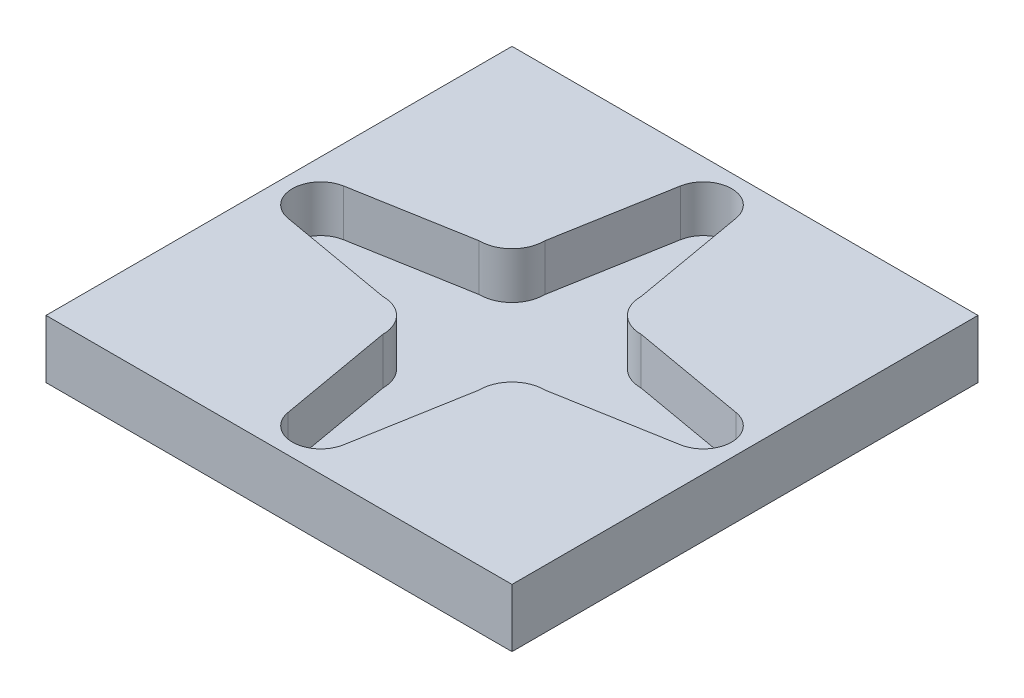
from build123d import *

# Parameters (mm, degrees)
SKETCH1_R             = 50
BOSS_EXTRUDE1_DEPTH   = 5
CAVITY1_START         = 1
CAVITY1_OUTLINE_R     = 4.45
CAVITY1_OUTLINE_R_2   = 3.45
CAVITY1_OUTLINE_R_3   = 2.9
CAVITY1_DEPTH         = 2.65
CAVITY1_START_2       = 2
CAVITY1_2_OUTLINE_R   = 4.45
CAVITY1_2_OUTLINE_R_2 = 3.45
CAVITY1_2_OUTLINE_R_3 = 2.9
CAVITY1_2_OUTLINE_R_4 = 1.5
CAVITY1_2_DEPTH       = 1.65
CAVITY1_START_3       = 3.65
CAVITY1_3_OUTLINE_R   = 4.25
CAVITY1_3_OUTLINE_R_2 = 3
CAVITY1_3_DEPTH       = 1.35
CUT_EXTRUDE4_DEPTH    = 4
CUT_EXTRUDE5_START    = -10
SKETCH4_R             = 50
SKETCH4_W             = 40
SKETCH4_H             = 40
CUT_EXTRUDE5_DEPTH    = 10


# Read off the part's stored shape, not the designer's step: Cavity1
with BuildPart() as part:
    # Sketch1 → Boss-Extrude1 (new body)
    with BuildSketch(Plane(origin=(0, 0, 0), x_dir=(1, 0, 0), z_dir=(0, 1, 0))):
        with Locations(Location((0, 0, 0), (0, 0, 270))):
            Circle(SKETCH1_R)
    extrude(amount=BOSS_EXTRUDE1_DEPTH)

    # Cavity1 outline → Cavity1 (cut)
    # profile 1 of 2: a face of its own
    with BuildSketch(Plane(origin=(0, 0, 0), x_dir=(1, 0, 0), z_dir=(0, 1, 0)).offset(CAVITY1_START)):
        with BuildLine():
            Line((-3.736481777, -6.923723208), (-2, -16.771800738))
            ThreePointArc((-2, -16.771800738), (0, -18.45), (2, -16.771800738))
            Line((2, -16.771800738), (3.736481777, -6.923723208))
            ThreePointArc((3.736481777, -6.923723208), (4.670003178, -4.670003178), (6.923723208, -3.736481777))
            Line((6.923723208, -3.736481777), (16.771800738, -2))
            ThreePointArc((16.771800738, -2), (18.45, 0), (16.771800738, 2))
            Line((16.771800738, 2), (6.923723208, 3.736481777))
            ThreePointArc((6.923723208, 3.736481777), (4.670003178, 4.670003178), (3.736481777, 6.923723208))
            Line((3.736481777, 6.923723208), (2, 16.771800738))
            ThreePointArc((2, 16.771800738), (0, 18.45), (-2, 16.771800738))
            Line((-2, 16.771800738), (-3.736481777, 6.923723208))
            ThreePointArc((-3.736481777, 6.923723208), (-4.670003178, 4.670003178), (-6.923723208, 3.736481777))
            Line((-6.923723208, 3.736481777), (-16.771800738, 2))
            ThreePointArc((-16.771800738, 2), (-18.45, 0), (-16.771800738, -2))
            Line((-16.771800738, -2), (-6.923723208, -3.736481777))
            ThreePointArc((-6.923723208, -3.736481777), (-4.670003178, -4.670003178), (-3.736481777, -6.923723208))
        make_face()
        Circle(CAVITY1_OUTLINE_R, mode=Mode.SUBTRACT)
    # profile 2 of 2: a face of its own
    with BuildSketch(Plane(origin=(0, 0, 0), x_dir=(1, 0, 0), z_dir=(0, 1, 0)).offset(CAVITY1_START)):
        Circle(CAVITY1_OUTLINE_R_2)
        Circle(CAVITY1_OUTLINE_R_3, mode=Mode.SUBTRACT)
    extrude(amount=CAVITY1_DEPTH, mode=Mode.SUBTRACT)

    # Cavity1 2 outline → Cavity1 2 (cut)
    # profile 1 of 2: a face of its own
    with BuildSketch(Plane(origin=(0, 0, 0), x_dir=(1, 0, 0), z_dir=(0, 1, 0)).offset(CAVITY1_START_2)):
        Circle(CAVITY1_2_OUTLINE_R)
        Circle(CAVITY1_2_OUTLINE_R_2, mode=Mode.SUBTRACT)
    # profile 2 of 2: a face of its own
    with BuildSketch(Plane(origin=(0, 0, 0), x_dir=(1, 0, 0), z_dir=(0, 1, 0)).offset(CAVITY1_START_2)):
        Circle(CAVITY1_2_OUTLINE_R_3)
        Circle(CAVITY1_2_OUTLINE_R_4, mode=Mode.SUBTRACT)
    extrude(amount=CAVITY1_2_DEPTH, mode=Mode.SUBTRACT)

    # Cavity1 3 outline → Cavity1 3 (cut)
    with BuildSketch(Plane(origin=(0, 0, 0), x_dir=(1, 0, 0), z_dir=(0, 1, 0)).offset(CAVITY1_START_3)):
        Circle(CAVITY1_3_OUTLINE_R)
        Circle(CAVITY1_3_OUTLINE_R_2, mode=Mode.SUBTRACT)
    extrude(amount=CAVITY1_3_DEPTH, mode=Mode.SUBTRACT)

    # Sketch2 → Cut-Extrude4 (cut)
    with BuildSketch(Plane(origin=(0, 1, 0), x_dir=(1, 0, 0), z_dir=(0, 1, 0))):
        with BuildLine():
            Line((-6.957554218, 4.136687101), (-16.841260009, 2.393923101))
            ThreePointArc((-16.841260009, 2.393923101), (-18.85, 0), (-16.841260009, -2.393923101))
            Line((-16.841260009, -2.393923101), (-6.957554218, -4.136687101))
            ThreePointArc((-6.957554218, -4.136687101), (-4.952845891, -4.952845891), (-4.136687101, -6.957554218))
            Line((-4.136687101, -6.957554218), (-2.393923101, -16.841260009))
            ThreePointArc((-2.393923101, -16.841260009), (0, -18.85), (2.393923101, -16.841260009))
            Line((2.393923101, -16.841260009), (4.136687101, -6.957554218))
            ThreePointArc((4.136687101, -6.957554218), (4.952845891, -4.952845891), (6.957554218, -4.136687101))
            Line((6.957554218, -4.136687101), (16.841260009, -2.393923101))
            ThreePointArc((16.841260009, -2.393923101), (18.85, 0), (16.841260009, 2.393923101))
            Line((16.841260009, 2.393923101), (6.957554218, 4.136687101))
            ThreePointArc((6.957554218, 4.136687101), (4.952845891, 4.952845891), (4.136687101, 6.957554218))
            Line((4.136687101, 6.957554218), (2.393923101, 16.841260009))
            ThreePointArc((2.393923101, 16.841260009), (0, 18.85), (-2.393923101, 16.841260009))
            Line((-2.393923101, 16.841260009), (-4.136687101, 6.957554218))
            ThreePointArc((-4.136687101, 6.957554218), (-4.952845891, 4.952845891), (-6.957554218, 4.136687101))
        make_face()
    extrude(amount=CUT_EXTRUDE4_DEPTH, mode=Mode.SUBTRACT)

    # Sketch4 → Cut-Extrude5 (cut)
    with BuildSketch(Plane(origin=(0, 5, 0), x_dir=(1, 0, 0), z_dir=(0, 1, 0)).offset(CUT_EXTRUDE5_START)):
        Circle(SKETCH4_R)
        Rectangle(SKETCH4_W, SKETCH4_H, mode=Mode.SUBTRACT)
    extrude(amount=CUT_EXTRUDE5_DEPTH, mode=Mode.SUBTRACT)


solid = part.part
